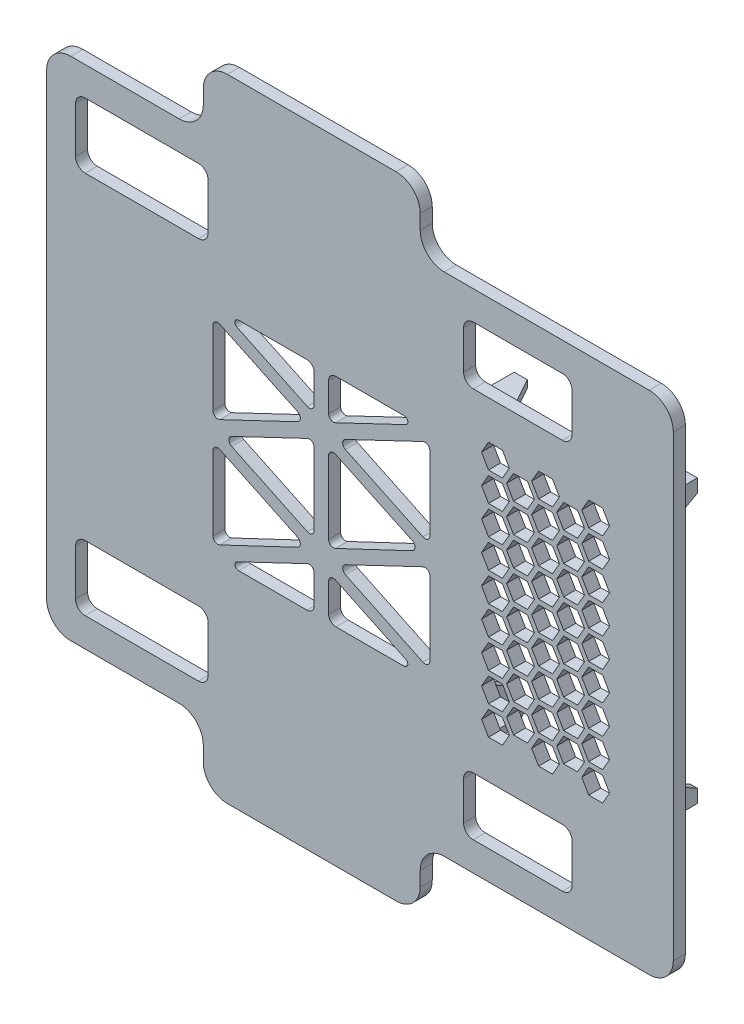
from build123d import *

# Parameters (mm, degrees)
EXTRUDE_1_DEPTH       = 5
EXTRUDE_2_DEPTH       = 20
CUT_EXTRUDE_3_DEPTH   = 10
CUT_EXTRUDE_4_DEPTH   = 10
MIRROR_2_COPY_1_DEPTH = 20
MIRROR_2_COPY_2_DEPTH = 10
MIRROR_2_COPY_3_DEPTH = 10
MIRROR_2_COPY_4_DEPTH = 20
MIRROR_2_COPY_5_DEPTH = 10
MIRROR_2_COPY_6_DEPTH = 10
CUT_EXTRUDE_5_DEPTH   = 5
SKETCH_9_W            = 55
SKETCH_9_H            = 27
SKETCH_9_W_2          = 45
SKETCH_9_H_2          = 24
CUT_EXTRUDE_6_DEPTH   = 5
FILLET_1_R            = 4
FILLET_2_R            = 1.5
FILLET_3_R            = 2
FILLET_4_R            = 3


with BuildPart() as part:
    # 草图1 → 凸台-拉伸1 (new body)
    with BuildSketch(Plane.XY):
        with BuildLine():
            Line((-130, 95), (-130, -95))
            ThreePointArc((-130, -95), (-127.071067812, -102.071067812), (-120, -105))
            Line((-120, -105), (-75, -105))
            ThreePointArc((-75, -105), (-67.928932188, -107.928932188), (-65, -115))
            Line((-65, -115), (-65, -121))
            ThreePointArc((-65, -121), (-62.071067812, -128.071067812), (-55, -131))
            Line((-55, -131), (15, -131))
            ThreePointArc((15, -131), (22.071067812, -128.071067812), (25, -121))
            Line((25, -121), (25, -115))
            ThreePointArc((25, -115), (27.928932188, -107.928932188), (35, -105))
            Line((35, -105), (120, -105))
            ThreePointArc((120, -105), (127.071067812, -102.071067812), (130, -95))
            Line((130, -95), (130, 95))
            ThreePointArc((130, 95), (127.071067812, 102.071067812), (120, 105))
            Line((120, 105), (35, 105))
            ThreePointArc((35, 105), (27.928932188, 107.928932188), (25, 115))
            Line((25, 115), (25, 121))
            ThreePointArc((25, 121), (22.071067812, 128.071067812), (15, 131))
            Line((15, 131), (-55, 131))
            ThreePointArc((-55, 131), (-62.071067812, 128.071067812), (-65, 121))
            Line((-65, 121), (-65, 115))
            ThreePointArc((-65, 115), (-67.928932188, 107.928932188), (-75, 105))
            Line((-75, 105), (-120, 105))
            ThreePointArc((-120, 105), (-127.071067812, 102.071067812), (-130, 95))
        make_face()
    extrude(amount=EXTRUDE_1_DEPTH)

    # 草图4 → 凸台-拉伸2 (add)
    with BuildSketch(Plane(origin=(0, 0, 0), x_dir=(-1, 0, 0), z_dir=(0, 0, -1))):
        Polygon((-39, -47.5), (-39, -58.5), (-50, -58.5), (-50, -55.5), (-42, -55.5), (-42, -47.5), align=None)
    extrude_2 = extrude(amount=EXTRUDE_2_DEPTH)

    # 草图5 → 切除-拉伸3 (cut)
    with BuildSketch(Plane.XZ.offset(58.5)):
        Polygon((50, -10), (44.5, -20), (50, -20), align=None)
    cut_extrude_3 = extrude(amount=-CUT_EXTRUDE_3_DEPTH, mode=Mode.SUBTRACT)

    # 草图6 → 切除-拉伸4 (cut)
    with BuildSketch(Plane.ZY.offset(-39)):
        Polygon((-20, -53), (-10, -47.5), (-20, -47.5), align=None)
    cut_extrude_4 = extrude(amount=-CUT_EXTRUDE_4_DEPTH, mode=Mode.SUBTRACT)

    # 镜向1: 凸台-拉伸2, 切除-拉伸3, 切除-拉伸4 across plane
    add(extrude_2.mirror(Plane(origin=(77, 0, 0), x_dir=(0, 0, 1), z_dir=(1, 0, 0))))
    add(cut_extrude_3.mirror(Plane(origin=(77, 0, 0), x_dir=(0, 0, 1), z_dir=(1, 0, 0))), mode=Mode.SUBTRACT)
    add(cut_extrude_4.mirror(Plane(origin=(77, 0, 0), x_dir=(0, 0, 1), z_dir=(1, 0, 0))), mode=Mode.SUBTRACT)

    # 镜向2 copy 1 sketch → 镜向2 copy 1 (add)
    with BuildSketch(Plane(origin=(154, 0, 0), x_dir=(1, 0, 0), z_dir=(0, 0, -1))):
        Polygon((-39, -47.5), (-39, -58.5), (-50, -58.5), (-50, -55.5), (-42, -55.5), (-42, -47.5), align=None)
    extrude(amount=MIRROR_2_COPY_1_DEPTH)

    # 镜向2 copy 2 sketch → 镜向2 copy 2 (cut)
    with BuildSketch(Plane(origin=(154, 58.5, 0), x_dir=(-1, 0, 0), z_dir=(0, 1, 0))):
        Polygon((50, -10), (44.5, -20), (50, -20), align=None)
    extrude(amount=-MIRROR_2_COPY_2_DEPTH, mode=Mode.SUBTRACT)

    # 镜向2 copy 3 sketch → 镜向2 copy 3 (cut)
    with BuildSketch(Plane(origin=(115, 0, 0), x_dir=(0, 0, 1), z_dir=(1, 0, 0))):
        Polygon((-20, -53), (-10, -47.5), (-20, -47.5), align=None)
    extrude(amount=-MIRROR_2_COPY_3_DEPTH, mode=Mode.SUBTRACT)

    # 镜向2 copy 4 sketch → 镜向2 copy 4 (add)
    with BuildSketch(Plane(origin=(0, 0, 0), x_dir=(-1, 0, 0), z_dir=(0, 0, -1))):
        Polygon((-39, 47.5), (-39, 58.5), (-50, 58.5), (-50, 55.5), (-42, 55.5), (-42, 47.5), align=None)
    extrude(amount=MIRROR_2_COPY_4_DEPTH)

    # 镜向2 copy 5 sketch → 镜向2 copy 5 (cut)
    with BuildSketch(Plane(origin=(0, 58.5, 0), x_dir=(1, 0, 0), z_dir=(0, 1, 0))):
        Polygon((50, 10), (44.5, 20), (50, 20), align=None)
    extrude(amount=-MIRROR_2_COPY_5_DEPTH, mode=Mode.SUBTRACT)

    # 镜向2 copy 6 sketch → 镜向2 copy 6 (cut)
    with BuildSketch(Plane.ZY.offset(-39)):
        Polygon((-20, 53), (-10, 47.5), (-20, 47.5), align=None)
    extrude(amount=-MIRROR_2_COPY_6_DEPTH, mode=Mode.SUBTRACT)

    # 草图7 → 切除-拉伸5 (cut)
    with BuildSketch(Plane(origin=(0, 0, 0), x_dir=(-1, 0, 0), z_dir=(0, 0, -1))):
        Polygon((-92.012994616, 36), (-94.899745962, 41), (-100.673248654, 41), (-103.56, 36), (-100.673248654, 31), (-94.899745962, 31), align=None)
        Polygon((-74.115136271, 31), (-71.228384925, 36), (-74.115136271, 41), (-79.888638963, 41), (-82.775390309, 36), (-79.888638963, 31), align=None)
        Polygon((-92.012994616, 24), (-94.899745962, 29), (-100.673248654, 29), (-103.56, 24), (-100.673248654, 19), (-94.899745962, 19), align=None)
        Polygon((-93.167695155, 30), (-90.280943809, 25), (-84.507441117, 25), (-81.620689771, 30), (-84.507441117, 35), (-90.280943809, 35), align=None)
        Polygon((-84.507441117, 37), (-81.620689771, 42), (-84.507441117, 47), (-90.280943809, 47), (-93.167695155, 42), (-90.280943809, 37), align=None)
        Polygon((-79.888638963, 43), (-74.115136271, 43), (-71.228384925, 48), (-74.115136271, 53), (-79.888638963, 53), (-82.775390309, 48), align=None)
        Polygon((-94.899745962, 43), (-92.012994616, 48), (-94.899745962, 53), (-100.673248654, 53), (-103.56, 48), (-100.673248654, 43), align=None)
        Polygon((-72.383085464, 42), (-69.496334118, 37), (-63.722831426, 37), (-60.83608008, 42), (-63.722831426, 47), (-69.496334118, 47), align=None)
        Polygon((-93.167695155, 18), (-90.280943809, 13), (-84.507441117, 13), (-81.620689771, 18), (-84.507441117, 23), (-90.280943809, 23), align=None)
        Polygon((-74.115136271, 19), (-71.228384925, 24), (-74.115136271, 29), (-79.888638963, 29), (-82.775390309, 24), (-79.888638963, 19), align=None)
        Polygon((-72.383085464, 30), (-69.496334118, 25), (-63.722831426, 25), (-60.83608008, 30), (-63.722831426, 35), (-69.496334118, 35), align=None)
        Polygon((-92.012994616, 12), (-94.899745962, 17), (-100.673248654, 17), (-103.56, 12), (-100.673248654, 7), (-94.899745962, 7), align=None)
        Polygon((-93.167695155, 6), (-90.280943809, 1), (-84.507441117, 1), (-81.620689771, 6), (-84.507441117, 11), (-90.280943809, 11), align=None)
        Polygon((-74.115136271, 7), (-71.228384925, 12), (-74.115136271, 17), (-79.888638963, 17), (-82.775390309, 12), (-79.888638963, 7), align=None)
        Polygon((-72.383085464, 18), (-69.496334118, 13), (-63.722831426, 13), (-60.83608008, 18), (-63.722831426, 23), (-69.496334118, 23), align=None)
        Polygon((-92.012994616, 0), (-94.899745962, 5), (-100.673248654, 5), (-103.56, 0), (-100.673248654, -5), (-94.899745962, -5), align=None)
        Polygon((-93.167695155, -6), (-90.280943809, -11), (-84.507441117, -11), (-81.620689771, -6), (-84.507441117, -1), (-90.280943809, -1), align=None)
        Polygon((-74.115136271, -5), (-71.228384925, 0), (-74.115136271, 5), (-79.888638963, 5), (-82.775390309, 0), (-79.888638963, -5), align=None)
        Polygon((-72.383085464, 6), (-69.496334118, 1), (-63.722831426, 1), (-60.83608008, 6), (-63.722831426, 11), (-69.496334118, 11), align=None)
        Polygon((-92.012994616, -12), (-94.899745962, -7), (-100.673248654, -7), (-103.56, -12), (-100.673248654, -17), (-94.899745962, -17), align=None)
        Polygon((-93.167695155, -18), (-90.280943809, -23), (-84.507441117, -23), (-81.620689771, -18), (-84.507441117, -13), (-90.280943809, -13), align=None)
        Polygon((-74.115136271, -17), (-71.228384925, -12), (-74.115136271, -7), (-79.888638963, -7), (-82.775390309, -12), (-79.888638963, -17), align=None)
        Polygon((-72.383085464, -6), (-69.496334118, -11), (-63.722831426, -11), (-60.83608008, -6), (-63.722831426, -1), (-69.496334118, -1), align=None)
        Polygon((-92.012994616, -24), (-94.899745962, -19), (-100.673248654, -19), (-103.56, -24), (-100.673248654, -29), (-94.899745962, -29), align=None)
        Polygon((-93.167695155, -30), (-90.280943809, -35), (-84.507441117, -35), (-81.620689771, -30), (-84.507441117, -25), (-90.280943809, -25), align=None)
        Polygon((-74.115136271, -29), (-71.228384925, -24), (-74.115136271, -19), (-79.888638963, -19), (-82.775390309, -24), (-79.888638963, -29), align=None)
        Polygon((-72.383085464, -18), (-69.496334118, -23), (-63.722831426, -23), (-60.83608008, -18), (-63.722831426, -13), (-69.496334118, -13), align=None)
        Polygon((-92.012994616, -36), (-94.899745962, -31), (-100.673248654, -31), (-103.56, -36), (-100.673248654, -41), (-94.899745962, -41), align=None)
        Polygon((-93.167695155, -42), (-90.280943809, -47), (-84.507441117, -47), (-81.620689771, -42), (-84.507441117, -37), (-90.280943809, -37), align=None)
        Polygon((-74.115136271, -41), (-71.228384925, -36), (-74.115136271, -31), (-79.888638963, -31), (-82.775390309, -36), (-79.888638963, -41), align=None)
        Polygon((-72.383085464, -30), (-69.496334118, -35), (-63.722831426, -35), (-60.83608008, -30), (-63.722831426, -25), (-69.496334118, -25), align=None)
        Polygon((-92.012994616, -48), (-94.899745962, -43), (-100.673248654, -43), (-103.56, -48), (-100.673248654, -53), (-94.899745962, -53), align=None)
        Polygon((-74.115136271, -53), (-71.228384925, -48), (-74.115136271, -43), (-79.888638963, -43), (-82.775390309, -48), (-79.888638963, -53), align=None)
        Polygon((-72.383085464, -42), (-69.496334118, -47), (-63.722831426, -47), (-60.83608008, -42), (-63.722831426, -37), (-69.496334118, -37), align=None)
        Polygon((-61.990780618, 36), (-59.104029272, 31), (-53.330526581, 31), (-50.443775235, 36), (-53.330526581, 41), (-59.104029272, 41), align=None)
        Polygon((-61.990780618, 48), (-59.104029272, 43), (-53.330526581, 43), (-50.443775235, 48), (-53.330526581, 53), (-59.104029272, 53), align=None)
        Polygon((-61.990780618, 24), (-59.104029272, 19), (-53.330526581, 19), (-50.443775235, 24), (-53.330526581, 29), (-59.104029272, 29), align=None)
        Polygon((-61.990780618, 12), (-59.104029272, 7), (-53.330526581, 7), (-50.443775235, 12), (-53.330526581, 17), (-59.104029272, 17), align=None)
        Polygon((-61.990780618, 0), (-59.104029272, -5), (-53.330526581, -5), (-50.443775235, 0), (-53.330526581, 5), (-59.104029272, 5), align=None)
        Polygon((-61.990780618, -12), (-59.104029272, -17), (-53.330526581, -17), (-50.443775235, -12), (-53.330526581, -7), (-59.104029272, -7), align=None)
        Polygon((-61.990780618, -24), (-59.104029272, -29), (-53.330526581, -29), (-50.443775235, -24), (-53.330526581, -19), (-59.104029272, -19), align=None)
        Polygon((-61.990780618, -36), (-59.104029272, -41), (-53.330526581, -41), (-50.443775235, -36), (-53.330526581, -31), (-59.104029272, -31), align=None)
        Polygon((-61.990780618, -48), (-59.104029272, -53), (-53.330526581, -53), (-50.443775235, -48), (-53.330526581, -43), (-59.104029272, -43), align=None)
    extrude(amount=-CUT_EXTRUDE_5_DEPTH, mode=Mode.SUBTRACT)

    # 草图9 → 切除-拉伸6 (cut)
    with BuildSketch(Plane(origin=(0, 0, 0), x_dir=(-1, 0, 0), z_dir=(0, 0, -1))):
        Polygon((9.804878049, 22.5), (-29, 41), (-29, 4), align=None)
        Polygon((13, -26.88372093), (-25, -45), (13, -45), align=None)
        Polygon((22.074593576, -22.557461202), (61, -41), (61, -4), align=None)
        Polygon((19, 26.88372093), (57, 45), (19, 45), align=None)
        Polygon((19, -18.11627907), (57, 0), (19, 18.11627907), align=None)
        with Locations((90.5, 79.5)):
            Rectangle(SKETCH_9_W, SKETCH_9_H)
        with Locations((90.5, -79.5)):
            Rectangle(SKETCH_9_W, SKETCH_9_H)
        with Locations((-65.5, 81)):
            Rectangle(SKETCH_9_W_2, SKETCH_9_H_2)
        with Locations((-65.5, -81)):
            Rectangle(SKETCH_9_W_2, SKETCH_9_H_2)
        Polygon((13, 45), (-25, 45), (13, 26.88372093), align=None)
        Polygon((61, 4), (61, 41), (22.074593576, 22.557461202), align=None)
        Polygon((13, 18.257993079), (-25.535898385, 0), (13, -18.257993079), align=None)
        Polygon((19, -45), (57, -45), (19, -26.88372093), align=None)
        Polygon((-29, -41), (9.804878049, -22.5), (-29, -4), align=None)
    extrude(amount=-CUT_EXTRUDE_6_DEPTH, mode=Mode.SUBTRACT)

    # 圆角1
    fillet_1_edges = [part.edges().sort_by_distance(p)[0] for p in [
        (-63, -93, 2.5),
        (-63, -66, 2.5),
        (-118, -93, 2.5),
        (-118, -66, 2.5),
        (-63, 66, 2.5),
        (-118, 66, 2.5),
        (-118, 93, 2.5),
        (-63, 93, 2.5),
        (43, -93, 2.5),
        (88, -69, 2.5),
        (43, -69, 2.5),
        (88, -93, 2.5),
        (88, 69, 2.5),
        (43, 69, 2.5),
        (43, 93, 2.5),
        (88, 93, 2.5),
    ]]
    fillet(fillet_1_edges, radius=FILLET_1_R)

    # 圆角2
    fillet_2_edges = [part.edges().sort_by_distance(p)[0] for p in [
        (25, -45, 2.5),
        (-57, -45, 2.5),
        (25, 45, 2.5),
        (-57, 45, 2.5),
    ]]
    fillet(fillet_2_edges, radius=FILLET_2_R)

    # 圆角3
    fillet_3_edges = [part.edges().sort_by_distance(p)[0] for p in [
        (29, -4, 2.5),
        (29, 4, 2.5),
        (-13, -18.257993079, 2.5),
        (-61, -41, 2.5),
        (-61, 4, 2.5),
        (-13, -26.88372093, 2.5),
        (-13, 18.257993079, 2.5),
        (-61, -4, 2.5),
        (-22.074593576, -22.557461202, 2.5),
        (25.535898385, 0, 2.5),
        (-22.074593576, 22.557461202, 2.5),
        (-61, 41, 2.5),
        (-19, 26.88372093, 2.5),
        (-19, -26.88372093, 2.5),
        (-19, -18.11627907, 2.5),
        (29, -41, 2.5),
        (29, 41, 2.5),
        (-57, 0, 2.5),
        (-9.804878049, -22.5, 2.5),
        (-13, 26.88372093, 2.5),
        (-9.804878049, 22.5, 2.5),
        (-19, 18.11627907, 2.5),
    ]]
    fillet(fillet_3_edges, radius=FILLET_3_R)

    # 圆角4
    fillet_4_edges = [part.edges().sort_by_distance(p)[0] for p in [
        (-13, -45, 2.5),
        (-13, 45, 2.5),
        (-19, -45, 2.5),
        (-19, 45, 2.5),
    ]]
    fillet(fillet_4_edges, radius=FILLET_4_R)


solid = part.part
